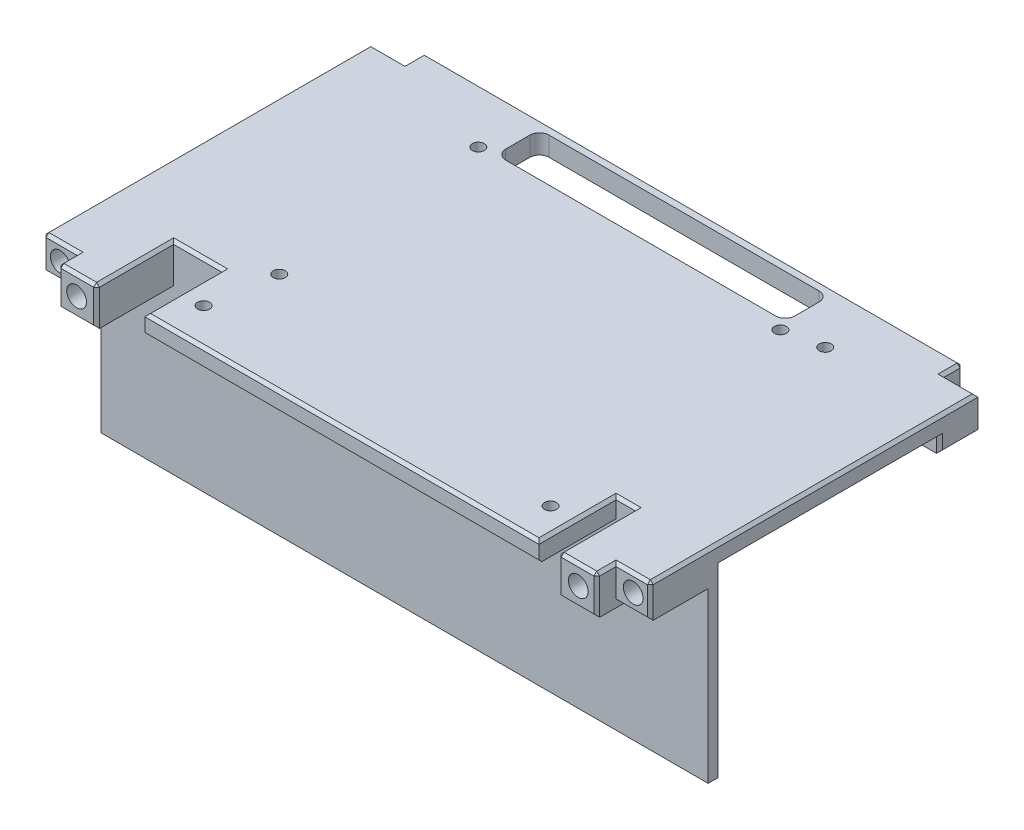
from build123d import *

# Parameters (mm, degrees)
BOSS_EXTRUDE1_DEPTH             = 4
SKETCH3_W                       = 7.1
SKETCH3_H                       = 8
BOSS_EXTRUDE3_DEPTH             = 3
SKETCH4_R                       = 2.05
CUT_EXTRUDE1_DEPTH              = 7
MIRROR2_COPY_1_SKETCH_W         = 7.1
MIRROR2_COPY_1_SKETCH_H         = 8
MIRROR2_COPY_1_DEPTH            = 3
MIRROR2_COPY_2_SKETCH_R         = 2.05
MIRROR2_COPY_2_DEPTH            = 7
SKETCH5_W                       = 60
SKETCH5_H                       = 9
CUT_EXTRUDE2_DEPTH              = 76.4917214
FILLET1_R                       = 2
SKETCH7_W                       = 111.8
SKETCH7_H                       = 1
CUT_EXTRUDE3_DEPTH              = 76.4917214
SKETCH8_W                       = 126
SKETCH8_H                       = 2
BOSS_EXTRUDE4_DEPTH             = 38
SKETCH9_W                       = 12
SKETCH9_H                       = 18
CUT_EXTRUDE4_DEPTH              = 10
SKETCH10_W                      = 7.1
SKETCH10_H                      = 4
BOSS_EXTRUDE5_DEPTH             = 3
SKETCH12_W                      = 1.5
SKETCH12_H                      = 4
BOSS_EXTRUDE6_DEPTH             = 2
SKETCH13_W                      = 40
SKETCH13_H                      = 2
BOSS_EXTRUDE7_DEPTH             = 38
SKETCH14_W                      = 1.5
SKETCH14_H                      = 4
BOSS_EXTRUDE8_DEPTH             = 1
BOSS_EXTRUDE9_REACH             = 85.744
BOSS_EXTRUDE9_DIRECTION_2_REACH = 85.744
SKETCH16_W                      = 20
SKETCH16_H                      = 14
SKETCH16_W_2                    = 14.5
SKETCH16_H_2                    = 9
BOSS_EXTRUDE10_DEPTH            = 4
SKETCH17_W                      = 12
SKETCH17_H                      = 18
CUT_EXTRUDE5_DEPTH              = 84.743656476
SKETCH18_W                      = 6
SKETCH18_H                      = 6
CUT_EXTRUDE6_DEPTH              = 86.632937588
SKETCH22_R                      = 1.25
CUT_EXTRUDE7_DEPTH              = 4
SKETCH25_W                      = 6
SKETCH25_H                      = 38
CUT_EXTRUDE11_DEPTH             = 10
CUT_EXTRUDE12_DEPTH             = 85.498520697
CUT_EXTRUDE12_DEPTH_BACK        = 85.498520697
SKETCH26_W                      = 7.701552738
SKETCH26_H                      = 30.562488548
SKETCH26_W_2                    = 6.53419365
SKETCH26_H_2                    = 28.524331859
SKETCH27_R                      = 1.25
CUT_EXTRUDE13_DEPTH             = 86.632937588
SKETCH28_W                      = 99.8
SKETCH28_H                      = 0.6
SKETCH28_W_2                    = 87.8
CUT_EXTRUDE14_DEPTH             = 86.632937588
SKETCH29_W                      = 87.8
SKETCH29_H                      = 1.4
CUT_EXTRUDE15_DEPTH             = 86.354320336
SKETCH30_W                      = 99.8
SKETCH30_H                      = 1.4
CUT_EXTRUDE16_DEPTH             = 86.354320336
SKETCH31_W                      = 2
SKETCH31_H                      = 4
CUT_EXTRUDE17_DEPTH             = 85.717176535
BOSS_EXTRUDE11_START            = -12
SKETCH32_W                      = 8
SKETCH32_H                      = 8
BOSS_EXTRUDE11_DEPTH            = 12
SKETCH33_R                      = 2.05
CUT_EXTRUDE18_DEPTH             = 10
MIRROR5_START                   = -26
MIRROR5_OUTLINE_W               = 8
MIRROR5_OUTLINE_H               = 8
MIRROR5_OUTLINE_R               = 2.05
MIRROR5_DEPTH                   = 64
MIRROR5_2_OUTLINE_R             = 2.05
MIRROR5_2_DEPTH                 = 54
SKETCH34_W                      = 6
SKETCH34_H                      = 16
CUT_EXTRUDE19_DEPTH             = 10
SKETCH35_W                      = 8
SKETCH35_H                      = 46
CUT_EXTRUDE20_DEPTH             = 4
SKETCH36_W                      = 14
SKETCH36_H                      = 6
BOSS_EXTRUDE12_DEPTH            = 1
SKETCH38_W                      = 14
SKETCH38_H                      = 6
BOSS_EXTRUDE13_DEPTH            = 3
CHAMFER1_SIZE                   = 1
SKETCH37_R                      = 1.6
CUT_EXTRUDE21_DEPTH             = 6
CHAMFER2_SIZE                   = 3
SKETCH39_W                      = 20
SKETCH39_H                      = 14
CUT_EXTRUDE22_DEPTH             = 16
CHAMFER3_SIZE                   = 0.6


# Read off the part's stored shape, not the designer's step: Mirror5
with BuildPart() as part:
    # Sketch1 → Boss-Extrude1 (new body)
    with BuildSketch(Plane(origin=(0, 0, 0), x_dir=(1, 0, 0), z_dir=(0, 1, 0))):
        Polygon((-63, -34), (-55.9, -34), (-55.9, -41), (55.9, -41), (55.9, -34), (63, -34), (63, 34), (55.9, 34), (55.9, 41), (-55.9, 41), (-55.9, 34), (-63, 34), align=None)
    extrude(amount=BOSS_EXTRUDE1_DEPTH)

    # Sketch3 → Boss-Extrude3 (add)
    with BuildSketch(Plane.XZ):
        with Locations((-59.45, -30)):
            Rectangle(SKETCH3_W, SKETCH3_H)
    boss_extrude3 = extrude(amount=BOSS_EXTRUDE3_DEPTH)

    # Sketch4 → Cut-Extrude1 (cut)
    with BuildSketch(Plane(origin=(0, 0, -34), x_dir=(-1, 0, 0), z_dir=(0, 0, -1))):
        with Locations((59.45, 0.5)):
            Circle(SKETCH4_R)
    cut_extrude1 = extrude(amount=-CUT_EXTRUDE1_DEPTH, mode=Mode.SUBTRACT)

    # Mirror1: Boss-Extrude3, Cut-Extrude1 across plane
    add(boss_extrude3.mirror(Plane(origin=(0, 0, 0), x_dir=(0, 0, 1), z_dir=(1, 0, 0))))
    add(cut_extrude1.mirror(Plane(origin=(0, 0, 0), x_dir=(0, 0, 1), z_dir=(1, 0, 0))), mode=Mode.SUBTRACT)

    # Mirror2: Boss-Extrude3, Cut-Extrude1 across plane
    add(boss_extrude3.mirror(Plane.XY))
    add(cut_extrude1.mirror(Plane.XY), mode=Mode.SUBTRACT)

    # Mirror2 copy 1 sketch → Mirror2 copy 1 (add)
    with BuildSketch(Plane(origin=(0, 0, 0), x_dir=(-1, 0, 0), z_dir=(0, -1, 0))):
        with Locations((-59.45, -30)):
            Rectangle(MIRROR2_COPY_1_SKETCH_W, MIRROR2_COPY_1_SKETCH_H)
    extrude(amount=MIRROR2_COPY_1_DEPTH)

    # Mirror2 copy 2 sketch → Mirror2 copy 2 (cut)
    with BuildSketch(Plane.XY.offset(34)):
        with Locations((59.45, 0.5)):
            Circle(MIRROR2_COPY_2_SKETCH_R)
    extrude(amount=-MIRROR2_COPY_2_DEPTH, mode=Mode.SUBTRACT)

    # Sketch5 → Cut-Extrude2 (cut, through all)
    with BuildSketch(Plane(origin=(0, 4, 0), x_dir=(1, 0, 0), z_dir=(0, 1, 0))):
        with Locations((0, 31.5)):
            Rectangle(SKETCH5_W, SKETCH5_H)
    extrude(amount=-CUT_EXTRUDE2_DEPTH, mode=Mode.SUBTRACT)

    # Fillet1
    fillet1_edges = [part.edges().sort_by_distance(p)[0] for p in [
        (-30, 2, -27),
        (-30, 2, -36),
        (30, 2, -36),
        (30, 2, -27),
    ]]
    fillet(fillet1_edges, radius=FILLET1_R)

    # Sketch7 → Cut-Extrude3 (cut, through all)
    with BuildSketch(Plane(origin=(0, 4, 0), x_dir=(1, 0, 0), z_dir=(0, 1, 0))):
        with Locations((0, 40.5)):
            Rectangle(SKETCH7_W, SKETCH7_H)
        with Locations((0, -40.5)):
            Rectangle(SKETCH7_W, SKETCH7_H)
    extrude(amount=-CUT_EXTRUDE3_DEPTH, mode=Mode.SUBTRACT)

    # Sketch8 → Boss-Extrude4 (add)
    with BuildSketch(Plane.XZ):
        with Locations((0, 21)):
            Rectangle(SKETCH8_W, SKETCH8_H)
    extrude(amount=BOSS_EXTRUDE4_DEPTH)

    # Sketch9 → Cut-Extrude4 (cut)
    with BuildSketch(Plane(origin=(0, 4, 0), x_dir=(1, 0, 0), z_dir=(0, 1, 0))):
        with Locations((-49.9, -31)):
            Rectangle(SKETCH9_W, SKETCH9_H)
    extrude(amount=-CUT_EXTRUDE4_DEPTH, mode=Mode.SUBTRACT)

    # Sketch10 → Boss-Extrude5 (add)
    with BuildSketch(Plane.XZ.offset(3)):
        with Locations((-59.45, 24)):
            Rectangle(SKETCH10_W, SKETCH10_H)
        with Locations((59.45, 24)):
            Rectangle(SKETCH10_W, SKETCH10_H)
    extrude(amount=-BOSS_EXTRUDE5_DEPTH)

    # Sketch12 → Boss-Extrude6 (add)
    # profile 1 of 2: a face of its own
    with BuildSketch(Plane.ZY.offset(56)):
        Polygon((22, -5.8), (22, -16.2), (24.7, -13.5), (24.7, -8.5), align=None)
        with Locations((23.35, -11)):
            Rectangle(SKETCH12_W, SKETCH12_H, mode=Mode.SUBTRACT)
    # profile 2 of 2: a face of its own
    with BuildSketch(Plane.ZY.offset(56)):
        Polygon((22, -20.8), (22, -31.2), (24.7, -28.5), (24.7, -23.5), align=None)
        with Locations((23.35, -26)):
            Rectangle(SKETCH12_W, SKETCH12_H, mode=Mode.SUBTRACT)
    boss_extrude6 = extrude(amount=-BOSS_EXTRUDE6_DEPTH)

    # Mirror3: Boss-Extrude6 across plane
    add(boss_extrude6.mirror(Plane(origin=(-49.9, 0, 0), x_dir=(0, 0, 1), z_dir=(1, 0, 0))))

    # Sketch13 → Boss-Extrude7 (add)
    with BuildSketch(Plane.XZ):
        with Locations((0, -18.5)):
            Rectangle(SKETCH13_W, SKETCH13_H)
    extrude(amount=BOSS_EXTRUDE7_DEPTH)

    # Sketch14 → Boss-Extrude8 (add, symmetric)
    # profile 1 of 2: a face of its own
    with BuildSketch(Plane(origin=(0, 0, 0), x_dir=(0, 0, -1), z_dir=(1, 0, 0))):
        Polygon((22.2, -8.5), (19.5, -5.8), (19.5, -16.2), (22.2, -13.5), align=None)
        with Locations((20.85, -11)):
            Rectangle(SKETCH14_W, SKETCH14_H, mode=Mode.SUBTRACT)
    # profile 2 of 2: a face of its own
    with BuildSketch(Plane(origin=(0, 0, 0), x_dir=(0, 0, -1), z_dir=(1, 0, 0))):
        Polygon((22.2, -28.5), (22.2, -23.5), (19.5, -20.8), (19.5, -31.2), align=None)
        with Locations((20.85, -26)):
            Rectangle(SKETCH14_W, SKETCH14_H, mode=Mode.SUBTRACT)
    extrude(amount=BOSS_EXTRUDE8_DEPTH, both=True)

    # Boss-Extrude9: up to this face of the body (flat: up to its plane)
    boss_extrude9_end = Plane(part.part.faces().sort_by_distance((-20, -19, -18.5))[0])
    # Sketch15 → Boss-Extrude9 (add, up to the picked face)
    with BuildSketch(Plane(origin=(0, 0, 0), x_dir=(0, 0, -1), z_dir=(1, 0, 0)), mode=Mode.PRIVATE) as boss_extrude9_sk1:
        Polygon((17.5, 0), (17.5, -5), (14.613248654, 0), align=None)
    boss_extrude9_tool1 = split(extrude(boss_extrude9_sk1.sketch, amount=-BOSS_EXTRUDE9_REACH, mode=Mode.PRIVATE), bisect_by=boss_extrude9_end, keep=Keep.BOTH, mode=Mode.PRIVATE)
    add(boss_extrude9_tool1.solids().sort_by(Axis((0, -1.666667, -16.53775), (-1, 0, 0)))[0])

    # Boss-Extrude9 direction 2: up to this face of the body (flat: up to its plane)
    boss_extrude9_direction_2_end = Plane(part.part.faces().sort_by_distance((20, -19, -18.5))[0])
    # Sketch15 → Boss-Extrude9 direction 2 (add, up to the picked face)
    with BuildSketch(Plane(origin=(0, 0, 0), x_dir=(0, 0, -1), z_dir=(1, 0, 0)), mode=Mode.PRIVATE) as boss_extrude9_direction_2_sk1:
        Polygon((17.5, 0), (17.5, -5), (14.613248654, 0), align=None)
    boss_extrude9_direction_2_tool1 = split(extrude(boss_extrude9_direction_2_sk1.sketch, amount=BOSS_EXTRUDE9_DIRECTION_2_REACH, mode=Mode.PRIVATE), bisect_by=boss_extrude9_direction_2_end, keep=Keep.BOTH, mode=Mode.PRIVATE)
    add(boss_extrude9_direction_2_tool1.solids().sort_by(Axis((0, -1.666667, -16.53775), (1, 0, 0)))[0])

    # Sketch16 → Boss-Extrude10 (add)
    with BuildSketch(Plane.XY.offset(40)):
        with Locations((30, -7)):
            Rectangle(SKETCH16_W, SKETCH16_H)
        with Locations((30, -7)):
            Rectangle(SKETCH16_W_2, SKETCH16_H_2, mode=Mode.SUBTRACT)
    extrude(amount=-BOSS_EXTRUDE10_DEPTH)

    # Sketch17 → Cut-Extrude5 (cut, through all)
    with BuildSketch(Plane.XZ):
        with Locations((49.9, 31)):
            Rectangle(SKETCH17_W, SKETCH17_H)
    extrude(amount=-CUT_EXTRUDE5_DEPTH, mode=Mode.SUBTRACT)

    # Sketch18 → Cut-Extrude6 (cut, through all)
    with BuildSketch(Plane(origin=(0, 4, 0), x_dir=(1, 0, 0), z_dir=(0, 1, 0))):
        with Locations((52.9, 37)):
            Rectangle(SKETCH18_W, SKETCH18_H)
        with Locations((-52.9, 37)):
            Rectangle(SKETCH18_W, SKETCH18_H)
    extrude(amount=-CUT_EXTRUDE6_DEPTH, mode=Mode.SUBTRACT)

    # Sketch22 → Cut-Extrude7 (cut)
    with BuildSketch(Plane(origin=(0, 4, 0), x_dir=(1, 0, 0), z_dir=(0, 1, 0))):
        with Locations(Location((31, 25, 0), (0, 0, 270))):
            Circle(SKETCH22_R)
        with Locations(Location((-31, -17, 0), (0, 0, 270))):
            Circle(SKETCH22_R)
    extrude(amount=-CUT_EXTRUDE7_DEPTH, mode=Mode.SUBTRACT)

    # Sketch25 → Cut-Extrude11 (cut)
    with BuildSketch(Plane(origin=(0, 0, -19.5), x_dir=(-1, 0, 0), z_dir=(0, 0, -1))):
        with Locations((-17, -19)):
            Rectangle(SKETCH25_W, SKETCH25_H)
        with Locations((17, -19)):
            Rectangle(SKETCH25_W, SKETCH25_H)
    extrude(amount=-CUT_EXTRUDE11_DEPTH, mode=Mode.SUBTRACT)

    # Sketch26 → Cut-Extrude12 (cut, two sides: drawn at the far end of the back side and taken through both)
    with BuildSketch(Plane.ZY.offset(1).offset(-CUT_EXTRUDE12_DEPTH_BACK)):
        with Locations((-23.350776369, -21.081244274)):
            Rectangle(SKETCH26_W, SKETCH26_H)
        with Locations((25.267096825, -20.06216593)):
            Rectangle(SKETCH26_W_2, SKETCH26_H_2)
    extrude(amount=CUT_EXTRUDE12_DEPTH + CUT_EXTRUDE12_DEPTH_BACK, mode=Mode.SUBTRACT)

    # Sketch27 → Cut-Extrude13 (cut, through all)
    with BuildSketch(Plane(origin=(0, 4, 0), x_dir=(1, 0, 0), z_dir=(0, 1, 0))):
        with Locations(Location((-33.2, 26.5, 0), (0, 0, 270))):
            Circle(SKETCH27_R)
        with Locations(Location((-33.2, -30.5, 0), (0, 0, 270))):
            Circle(SKETCH27_R)
        with Locations(Location((38.8, -30.5, 0), (0, 0, 270))):
            Circle(SKETCH27_R)
        with Locations(Location((38.8, 26.5, 0), (0, 0, 270))):
            Circle(SKETCH27_R)
    extrude(amount=-CUT_EXTRUDE13_DEPTH, mode=Mode.SUBTRACT)

    # Sketch28 → Cut-Extrude14 (cut, through all)
    with BuildSketch(Plane(origin=(0, 4, 0), x_dir=(1, 0, 0), z_dir=(0, 1, 0))):
        with Locations((0, 39.7)):
            Rectangle(SKETCH28_W, SKETCH28_H)
        with Locations((0, -39.7)):
            Rectangle(SKETCH28_W_2, SKETCH28_H)
    extrude(amount=-CUT_EXTRUDE14_DEPTH, mode=Mode.SUBTRACT)

    # Sketch29 → Cut-Extrude15 (cut, through all)
    with BuildSketch(Plane(origin=(0, 4, 0), x_dir=(1, 0, 0), z_dir=(0, 1, 0))):
        with Locations((0, -38.7)):
            Rectangle(SKETCH29_W, SKETCH29_H)
    extrude(amount=-CUT_EXTRUDE15_DEPTH, mode=Mode.SUBTRACT)

    # Sketch30 → Cut-Extrude16 (cut, through all)
    with BuildSketch(Plane(origin=(0, 4, 0), x_dir=(1, 0, 0), z_dir=(0, 1, 0))):
        with Locations((0, 38.7)):
            Rectangle(SKETCH30_W, SKETCH30_H)
    extrude(amount=-CUT_EXTRUDE16_DEPTH, mode=Mode.SUBTRACT)

    # Sketch31 → Cut-Extrude17 (cut, through all)
    with BuildSketch(Plane(origin=(0, 4, 0), x_dir=(1, 0, 0), z_dir=(0, 1, 0))):
        with Locations((-48.9, 36)):
            Rectangle(SKETCH31_W, SKETCH31_H)
        with Locations((48.9, 36)):
            Rectangle(SKETCH31_W, SKETCH31_H)
    extrude(amount=-CUT_EXTRUDE17_DEPTH, mode=Mode.SUBTRACT)

    # Sketch32 → Boss-Extrude11 (add)
    with BuildSketch(Plane(origin=(0, 0, -38), x_dir=(-1, 0, 0), z_dir=(0, 0, -1)).offset(BOSS_EXTRUDE11_START)):
        with Locations((-51.9, 0)):
            Rectangle(SKETCH32_W, SKETCH32_H)
    boss_extrude11 = extrude(amount=BOSS_EXTRUDE11_DEPTH)

    # Sketch33 → Cut-Extrude18 (cut)
    with BuildSketch(Plane(origin=(0, 0, -38), x_dir=(-1, 0, 0), z_dir=(0, 0, -1))):
        with Locations((-52.05, 0)):
            Circle(SKETCH33_R)
    cut_extrude18 = extrude(amount=-CUT_EXTRUDE18_DEPTH, mode=Mode.SUBTRACT)

    # Mirror4: Boss-Extrude11, Cut-Extrude18 across plane
    add(boss_extrude11.mirror(Plane(origin=(0, 0, 0), x_dir=(0, 0, 1), z_dir=(1, 0, 0))))
    add(cut_extrude18.mirror(Plane(origin=(0, 0, 0), x_dir=(0, 0, 1), z_dir=(1, 0, 0))), mode=Mode.SUBTRACT)

    # Mirror5 outline → Mirror5 (add)
    # profile 1 of 2: a face of its own
    with BuildSketch(Plane.XY.offset(MIRROR5_START)):
        with Locations((51.9, 0)):
            Rectangle(MIRROR5_OUTLINE_W, MIRROR5_OUTLINE_H)
        with Locations((52.05, 0)):
            Circle(MIRROR5_OUTLINE_R, mode=Mode.SUBTRACT)
    # profile 2 of 2: a face of its own
    with BuildSketch(Plane.XY.offset(MIRROR5_START)):
        with Locations((-51.9, 0)):
            Rectangle(MIRROR5_OUTLINE_W, MIRROR5_OUTLINE_H)
        with Locations((-52.05, 0)):
            Circle(MIRROR5_OUTLINE_R, mode=Mode.SUBTRACT)
    extrude(amount=MIRROR5_DEPTH)

    # Mirror5 2 outline → Mirror5 2 (add)
    with BuildSketch(Plane.XY.offset(MIRROR5_START)):
        with Locations((52.05, 0)):
            Circle(MIRROR5_2_OUTLINE_R)
        with Locations((-52.05, 0)):
            Circle(MIRROR5_2_OUTLINE_R)
    extrude(amount=MIRROR5_2_DEPTH)

    # Sketch34 → Cut-Extrude19 (cut)
    with BuildSketch(Plane(origin=(0, 4, 0), x_dir=(1, 0, 0), z_dir=(0, 1, 0))):
        with Locations((-40.9, -30)):
            Rectangle(SKETCH34_W, SKETCH34_H)
    extrude(amount=-CUT_EXTRUDE19_DEPTH, mode=Mode.SUBTRACT)

    # Sketch35 → Cut-Extrude20 (cut)
    with BuildSketch(Plane.XZ.offset(4)):
        with Locations((-51.9, -3)):
            Rectangle(SKETCH35_W, SKETCH35_H)
        with Locations((51.9, -3)):
            Rectangle(SKETCH35_W, SKETCH35_H)
    extrude(amount=-CUT_EXTRUDE20_DEPTH, mode=Mode.SUBTRACT)

    # Sketch36 → Boss-Extrude12 (add)
    with BuildSketch(Plane(origin=(0, 0, -19.5), x_dir=(-1, 0, 0), z_dir=(0, 0, -1))):
        with Locations((0, -19)):
            Rectangle(SKETCH36_W, SKETCH36_H)
    extrude(amount=BOSS_EXTRUDE12_DEPTH)

    # Sketch38 → Boss-Extrude13 (add)
    with BuildSketch(Plane.XY.offset(-17.5)):
        with Locations((0, -19)):
            Rectangle(SKETCH38_W, SKETCH38_H)
    extrude(amount=BOSS_EXTRUDE13_DEPTH)

    # Chamfer1
    chamfer1_edges = [part.edges().sort_by_distance(p)[0] for p in [
        (0, -16, -19.5),
    ]]
    chamfer(chamfer1_edges, length=CHAMFER1_SIZE - 0.0001)  # a hair under: the kernel refuses the full size

    # Sketch37 → Cut-Extrude21 (cut)
    with BuildSketch(Plane(origin=(0, 0, -20.5), x_dir=(-1, 0, 0), z_dir=(0, 0, -1))):
        with Locations((-4, -19)):
            Circle(SKETCH37_R)
        with Locations((4, -19)):
            Circle(SKETCH37_R)
    extrude(amount=-CUT_EXTRUDE21_DEPTH, mode=Mode.SUBTRACT)

    # Chamfer2
    chamfer2_edges = [part.edges().sort_by_distance(p)[0] for p in [
        (0, -16, -17.5),
    ]]
    chamfer(chamfer2_edges, length=CHAMFER2_SIZE - 0.0001)  # a hair under: the kernel refuses the full size

    # Sketch39 → Cut-Extrude22 (cut)
    with BuildSketch(Plane.XY.offset(38)):
        with Locations((30, -7)):
            Rectangle(SKETCH39_W, SKETCH39_H)
    extrude(amount=-CUT_EXTRUDE22_DEPTH, mode=Mode.SUBTRACT)

    # Chamfer3
    chamfer3_edges = [part.edges().sort_by_distance(p)[0] for p in [
        (-63, 0, -3),
        (63, 0, -3),
        (0, 0, -38),
        (59.45, 4, -34),
        (55.9, 4, -36),
        (0, 4, -38),
        (-55.9, 4, -36),
        (-59.45, 4, -34),
        (-63, 4, 0),
        (-59.45, 4, 34),
        (-55.9, 4, 36),
        (-51.9, 4, 38),
        (-47.9, 4, 30),
        (-42.9, 4, 22),
        (-37.9, 4, 30),
        (3, 4, 38),
        (43.9, 4, 30),
        (45.9, 4, 22),
        (47.9, 4, 30),
        (51.9, 4, 38),
        (55.9, 4, 36),
        (59.45, 4, 34),
        (63, 4, 0),
        (3, 0, 38),
        (63, 0.5, 34),
        (59.45, -3, 34),
        (55.9, 0, 38),
        (51.9, -4, 38),
        (47.9, 0, 38),
        (-51.9, -4, 38),
        (-59.45, -3, 34),
        (-47.9, 0, 38),
        (-55.9, 0, 38),
        (-63, 0.5, 34),
        (-59.45, -3, -34),
        (-63, 0.5, -34),
        (-63, -3, -30),
        (-55.9, 0, -38),
        (-51.9, -4, -38),
        (55.9, 0, -38),
        (51.9, -4, -38),
        (59.45, -3, -34),
        (63, -3, -30),
        (47.9, -2, -38),
        (-47.9, -2, -38),
        (63, -1.5, -26),
        (-63, -1.5, -26),
    ]]
    chamfer(chamfer3_edges, length=CHAMFER3_SIZE)


solid = part.part
